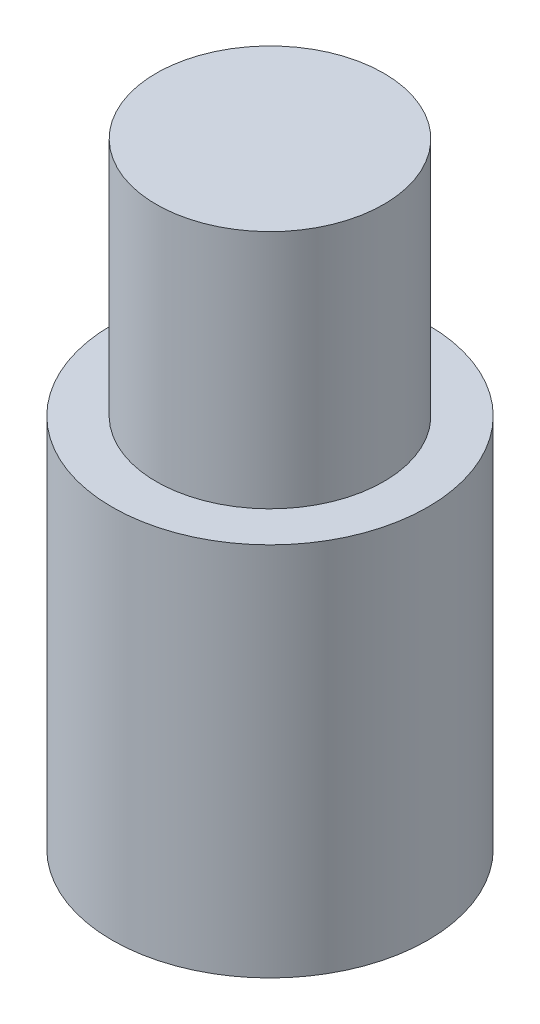
from build123d import *


with BuildPart() as part:
    # Sketch2 → Revolve3 (revolve)
    with BuildSketch(Plane.XY):
        Polygon((0, 26.035), (0, 12.7), (4.7625, 12.7), (4.7625, 0), (6.6802, 0), (6.6802, 15.875), (4.8133, 15.875), (4.8133, 26.035), align=None)
    revolve(axis=Axis((0, 0, 0), (0, 1, 0)))


solid = part.part
